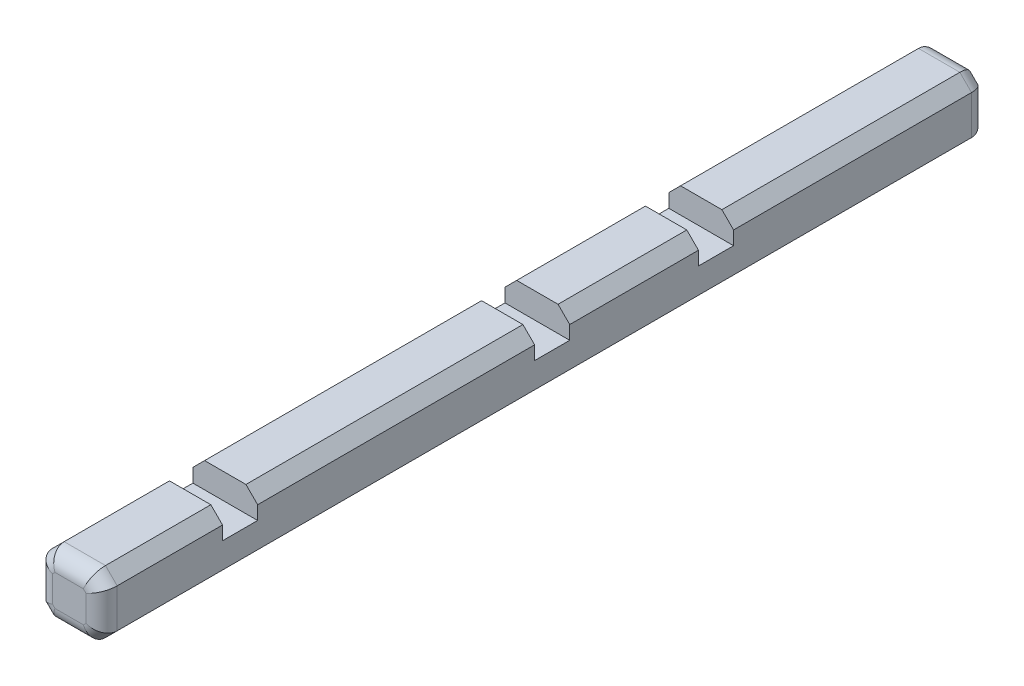
from build123d import *

# Parameters (mm, degrees)
SKETCH1_W           = 8.3
SKETCH1_H           = 8
BOSS_EXTRUDE1_DEPTH = 113.5
CHAMFER2_SIZE       = 1.5
SKETCH3_W           = 8.3
SKETCH3_H           = 3.25
CUT_EXTRUDE1_DEPTH  = 4.5
SKETCH4_W           = 8.3
SKETCH4_H           = 3.25
CUT_EXTRUDE2_DEPTH  = 4.5
FILLET1_R           = 2
SKETCH6_W           = 8.3
SKETCH6_H           = 3.25
CUT_EXTRUDE3_DEPTH  = 4.5


with BuildPart() as part:
    # Sketch1 → Boss-Extrude1 (new body)
    with BuildSketch(Plane.XY):
        Rectangle(SKETCH1_W, SKETCH1_H)
    extrude(amount=BOSS_EXTRUDE1_DEPTH)

    # Chamfer2
    chamfer2_edges = [part.edges().sort_by_distance(p)[0] for p in [
        (4.15, -4, 56.75),
        (-4.15, -4, 56.75),
        (4.15, 4, 56.75),
        (-4.15, 4, 56.75),
    ]]
    chamfer(chamfer2_edges, length=CHAMFER2_SIZE)

    # Sketch3 → Cut-Extrude1 (cut)
    with BuildSketch(Plane(origin=(0, 0, 58), x_dir=(-1, 0, 0), z_dir=(0, 0, -1))):
        with Locations((0, 2.375)):
            Rectangle(SKETCH3_W, SKETCH3_H)
    extrude(amount=CUT_EXTRUDE1_DEPTH, mode=Mode.SUBTRACT)

    # Sketch4 → Cut-Extrude2 (cut)
    with BuildSketch(Plane(origin=(0, 0, 98), x_dir=(-1, 0, 0), z_dir=(0, 0, -1))):
        with Locations((0, 2.375)):
            Rectangle(SKETCH4_W, SKETCH4_H)
    extrude(amount=CUT_EXTRUDE2_DEPTH, mode=Mode.SUBTRACT)

    # Fillet1
    fillet1_edges = [part.edges().sort_by_distance(p)[0] for p in [
        (0, 4, 0),
        (-4.15, 0, 0),
        (0, -4, 0),
        (4.15, 0, 0),
        (-4.15, 0, 113.5),
        (0, 4, 113.5),
        (4.15, 0, 113.5),
        (0, -4, 113.5),
        (3.4, 3.25, 0),
        (-3.4, 3.25, 0),
        (-3.4, -3.25, 0),
        (3.4, -3.25, 0),
        (-3.4, -3.25, 113.5),
        (-3.4, 3.25, 113.5),
        (3.4, 3.25, 113.5),
        (3.4, -3.25, 113.5),
    ]]
    fillet(fillet1_edges, radius=FILLET1_R)

    # Sketch6 → Cut-Extrude3 (cut)
    with BuildSketch(Plane(origin=(0, 0, 37), x_dir=(-1, 0, 0), z_dir=(0, 0, -1))):
        with Locations((0, 2.375)):
            Rectangle(SKETCH6_W, SKETCH6_H)
    extrude(amount=CUT_EXTRUDE3_DEPTH, mode=Mode.SUBTRACT)


solid = part.part
